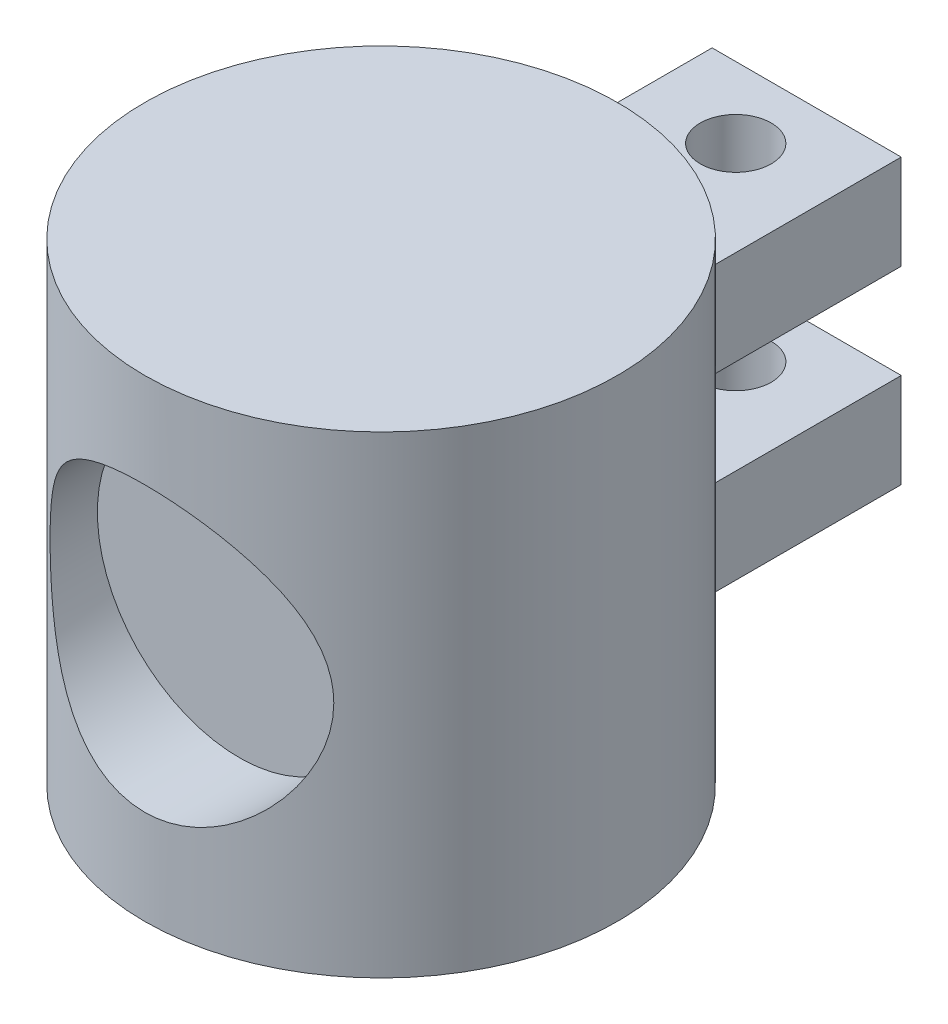
from build123d import *

# Parameters (mm, degrees)
SKETCH1_R                = 50
BOSS_EXTRUDE1_DEPTH      = 100
SKETCH2_R                = 30
CUT_EXTRUDE1_DEPTH       = 20
BOSS_EXTRUDE4_REACH      = 181.165
BOSS_EXTRUDE4_END_RADIUS = 50
SKETCH9_W                = 40
SKETCH9_H                = 20
SKETCH10_R               = 7.5
CUT_EXTRUDE4_DEPTH       = 100


with BuildPart() as part:
    # Sketch1 → Boss-Extrude1 (new body)
    with BuildSketch(Plane(origin=(0, 0, 0), x_dir=(1, 0, 0), z_dir=(0, 1, 0))):
        Circle(SKETCH1_R)
    extrude(amount=BOSS_EXTRUDE1_DEPTH)

    # Sketch2 → Cut-Extrude1 (cut)
    with BuildSketch(Plane.XY.offset(50)):
        with Locations((0, 50)):
            Circle(SKETCH2_R)
    extrude(amount=-CUT_EXTRUDE1_DEPTH, mode=Mode.SUBTRACT)

    # Boss-Extrude4: up to this cylinder (the profile starts outside it)
    boss_extrude4_end = Plane(origin=(0, 50, 0), z_dir=(0, -1, 0)) * Cylinder(BOSS_EXTRUDE4_END_RADIUS, 503.33, mode=Mode.PRIVATE)
    # Sketch9 → Boss-Extrude4 (add, up to the surface)
    with BuildSketch(Plane.XY.offset(-90), mode=Mode.PRIVATE) as boss_extrude4_sk1:
        with Locations((0, 70)):
            Rectangle(SKETCH9_W, SKETCH9_H)
    boss_extrude4_tool1 = extrude(boss_extrude4_sk1.sketch, amount=BOSS_EXTRUDE4_REACH, mode=Mode.PRIVATE) - boss_extrude4_end
    add(boss_extrude4_tool1.solids().sort_by_distance((0, 70, -90))[0])
    # Sketch9 → Boss-Extrude4 (add, up to the surface)
    with BuildSketch(Plane.XY.offset(-90), mode=Mode.PRIVATE) as boss_extrude4_sk2:
        with Locations((0, 30)):
            Rectangle(SKETCH9_W, SKETCH9_H)
    boss_extrude4_tool2 = extrude(boss_extrude4_sk2.sketch, amount=BOSS_EXTRUDE4_REACH, mode=Mode.PRIVATE) - boss_extrude4_end
    add(boss_extrude4_tool2.solids().sort_by_distance((0, 30, -90))[0])

    # Sketch10 → Cut-Extrude4 (cut)
    with BuildSketch(Plane(origin=(0, 80, 0), x_dir=(1, 0, 0), z_dir=(0, 1, 0))):
        with Locations((0, 75)):
            Circle(SKETCH10_R)
    extrude(amount=-CUT_EXTRUDE4_DEPTH, mode=Mode.SUBTRACT)


solid = part.part
